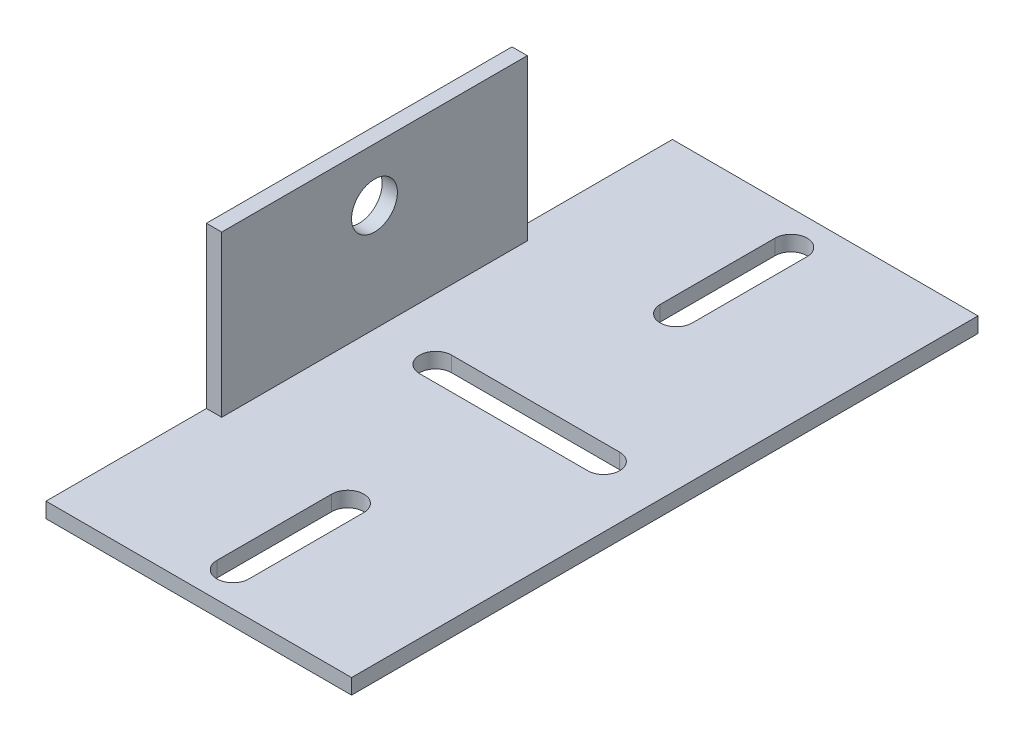
from build123d import *

# Parameters (mm, degrees)
EXTRUDE_1_DEPTH     = 82
CUT_EXTRUDE_1_DEPTH = 10
SKETCH_4_R          = 3
CUT_EXTRUDE_2_DEPTH = 10
SKETCH_5_W          = 21
SKETCH_5_H          = 21
CUT_EXTRUDE_3_DEPTH = 10


with BuildPart() as part:
    # Эскиз2 → Вытянуть-Тонкостенный1 (new body)
    with BuildSketch(Plane.XY):
        Polygon((0, 23), (0, 0), (40, 0), (40, 2), (2, 2), (2, 23), align=None)
    extrude(amount=EXTRUDE_1_DEPTH)

    # Эскиз3 → Вырез-Вытянуть1 (cut)
    with BuildSketch(Plane(origin=(0, 2, 0), x_dir=(1, 0, 0), z_dir=(0, 1, 0))):
        with BuildLine():
            Line((32, -38.9), (10, -38.9))
            ThreePointArc((10, -38.9), (7.9, -41), (10, -43.1))
            Line((10, -43.1), (32, -43.1))
            ThreePointArc((32, -43.1), (34.1, -41), (32, -38.9))
        make_face()
        with BuildLine():
            Line((17.9, -4.467861833), (17.9, -19.5))
            ThreePointArc((17.9, -19.5), (20, -21.6), (22.1, -19.5))
            Line((22.1, -19.5), (22.1, -4.467861833))
            ThreePointArc((22.1, -4.467861833), (20, -2.367861833), (17.9, -4.467861833))
        make_face()
        with BuildLine():
            Line((22.1, -77.532138167), (22.1, -62.5))
            ThreePointArc((22.1, -62.5), (20, -60.4), (17.9, -62.5))
            Line((17.9, -62.5), (17.9, -77.532138167))
            ThreePointArc((17.9, -77.532138167), (20, -79.632138167), (22.1, -77.532138167))
        make_face()
    extrude(amount=-CUT_EXTRUDE_1_DEPTH, mode=Mode.SUBTRACT)

    # Эскиз4 → Вырез-Вытянуть2 (cut)
    with BuildSketch(Plane.ZY):
        with Locations((41, 16)):
            Circle(SKETCH_4_R)
    extrude(amount=-CUT_EXTRUDE_2_DEPTH, mode=Mode.SUBTRACT)

    # Эскиз5 → Вырез-Вытянуть3 (cut)
    with BuildSketch(Plane.ZY):
        with Locations((10.5, 12.5)):
            Rectangle(SKETCH_5_W, SKETCH_5_H)
        with Locations((71.5, 12.5)):
            Rectangle(SKETCH_5_W, SKETCH_5_H)
    extrude(amount=-CUT_EXTRUDE_3_DEPTH, mode=Mode.SUBTRACT)


solid = part.part
